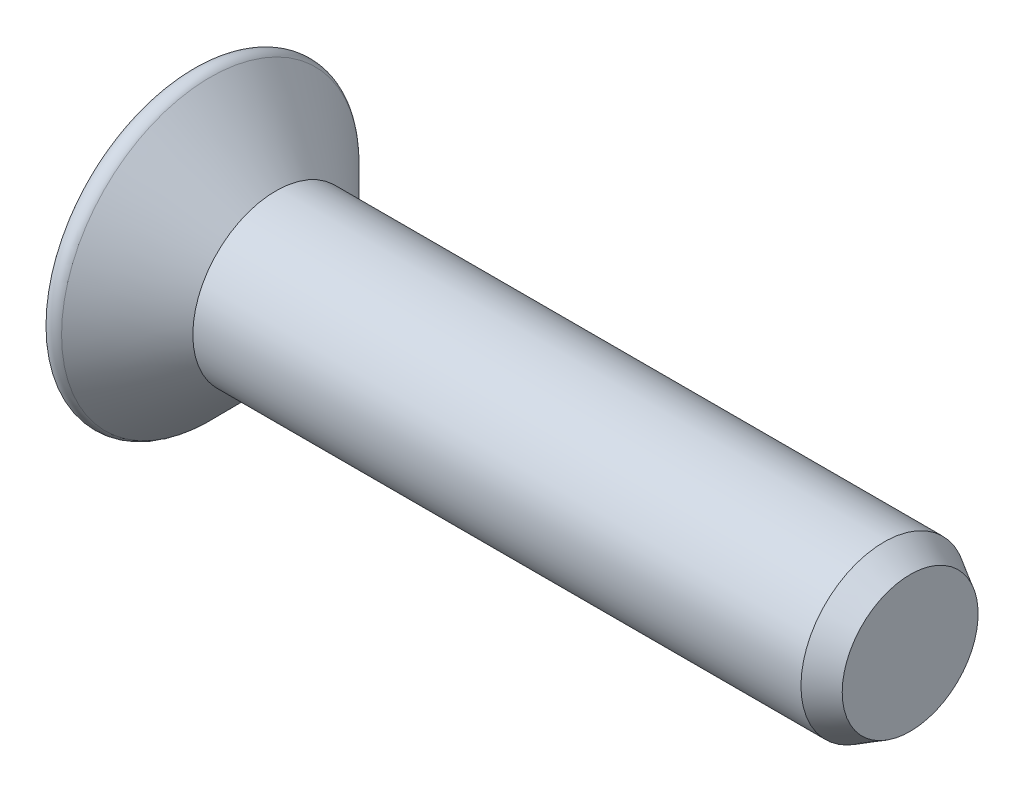
from build123d import *

# Parameters (mm, degrees)
CHAMFER1_SIZE      = 0.2
CHAMFER1_SIZE2     = 0.346410162
CUT_EXTRUDE1_DEPTH = 0.8
CUT_EXTRUDE1_TAPER = 6


with BuildPart() as part:
    # Sketch1 → Revolve1 (revolve)
    with BuildSketch(Plane.XY):
        with BuildLine():
            Line((-1.6, 0), (8.4, 0))
            Line((8.4, 0), (8.4, 1.1))
            Line((8.4, 1.1), (0, 1.1))
            Line((0, 1.1), (-0.869043005, 1.969043005))
            ThreePointArc((-0.869043005, 1.969043005), (-0.992640239, 2.010371092), (-1.1, 1.936491673))
            ThreePointArc((-1.1, 1.936491673), (-1.472983346, 1), (-1.6, 0))
        make_face()
    revolve(axis=Axis((0, 0, 0), (1, 0, 0)))

    # Chamfer1
    chamfer1_edges = [part.edges().sort_by_distance(p)[0] for p in [
        (8.4, -1.1, 0),
    ]]
    chamfer1_side = [part.faces().sort_by_distance(p)[0] for p in [
        (8.4, 0, 0),
    ]]
    chamfer(chamfer1_edges, length=CHAMFER1_SIZE, length2=CHAMFER1_SIZE2, reference=chamfer1_side[0])

    # Sketch3 → Cut-Extrude1 (cut)
    with BuildSketch(Plane(origin=(-1.6, 0, 0), x_dir=(0, 0, -1), z_dir=(1, 0, 0))):
        Polygon((-0.22, 1.1), (-0.146666667, 0.733333333), (-0.36140157, 0.36140157), (-0.733333333, 0.146666667), (-1.1, 0.22), (-1.1, -0.22), (-0.733333333, -0.146666667), (-0.36140157, -0.36140157), (-0.146666667, -0.733333333), (-0.22, -1.1), (0.22, -1.1), (0.146666667, -0.733333333), (0.36140157, -0.36140157), (0.733333333, -0.146666667), (1.1, -0.22), (1.1, 0.22), (0.733333333, 0.146666667), (0.36140157, 0.36140157), (0.146666667, 0.733333333), (0.22, 1.1), align=None)
    extrude(amount=CUT_EXTRUDE1_DEPTH, taper=CUT_EXTRUDE1_TAPER, mode=Mode.SUBTRACT)


solid = part.part
